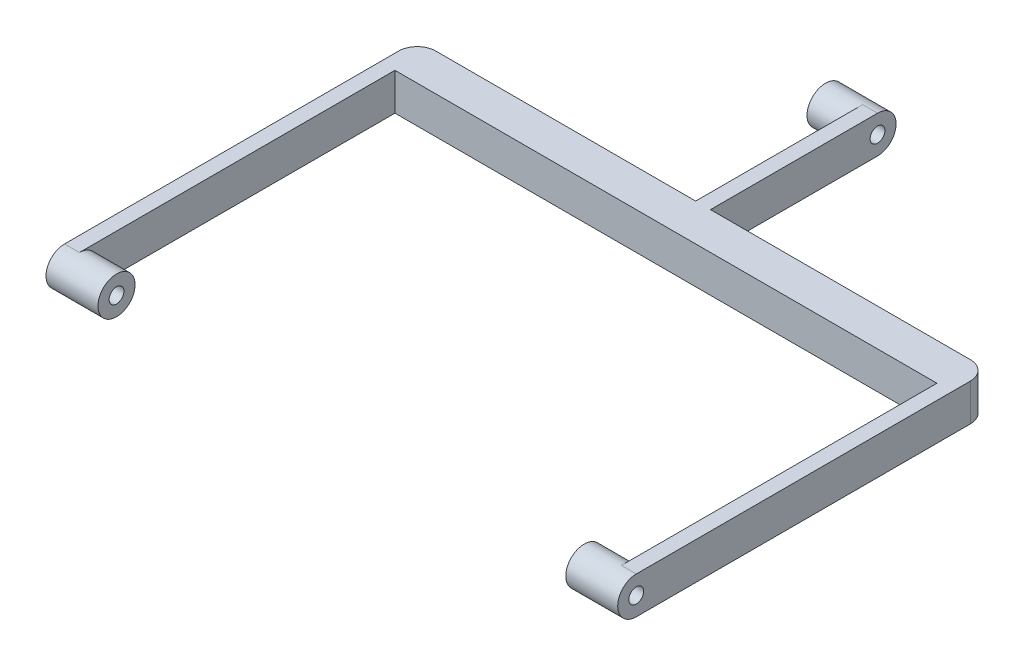
from build123d import *

# Parameters (mm, degrees)
ESBO_O1_W                  = 77
ESBO_O1_H                  = 5
RESSALTO_EXTRUS_O1_DEPTH   = 5
ESBO_O2_W                  = 2
ESBO_O2_H                  = 50
RESSALTO_EXTRUS_O2_DEPTH   = 5
FILETE1_R                  = 2.5
ESBO_O7_R                  = 2.5
RESSALTO_EXTRUS_O5_DEPTH   = 5
ESBO_O3_R                  = 1
CORTE_EXTRUS_O1_DEPTH      = 62.347371582
FILETE1_OF_ESPELHAR1_R     = 2.5
FILETE2_R                  = 2.5
ESBO_O4_W                  = 30
ESBO_O4_H                  = 5
RESSALTO_EXTRUS_O3_DEPTH   = 1
FILETE3_R                  = 2.5
ESBO_O6_R                  = 2.5
RESSALTO_EXTRUS_O4_DEPTH   = 5
CORTE_EXTRUS_O2_DEPTH      = 62.347371582
CORTE_EXTRUS_O2_DEPTH_BACK = 62.347371582
ESBO_O5_R                  = 1


with BuildPart() as part:
    # Esboço1 → Ressalto-extrusão1 (new body)
    with BuildSketch(Plane(origin=(0, 0, 0), x_dir=(1, 0, 0), z_dir=(0, 1, 0))):
        Rectangle(ESBO_O1_W, ESBO_O1_H)
    extrude(amount=RESSALTO_EXTRUS_O1_DEPTH)

    # Esboço2 → Ressalto-extrusão2 (add)
    with BuildSketch(Plane(origin=(0, 0, 0), x_dir=(1, 0, 0), z_dir=(0, 1, 0))):
        with Locations((-37.5, -22.5)):
            Rectangle(ESBO_O2_W, ESBO_O2_H)
    ressalto_extrus_o2 = extrude(amount=RESSALTO_EXTRUS_O2_DEPTH)

    # Filete1
    filete1_edges = [part.edges().sort_by_distance(p)[0] for p in [
        (-37.5, 0, 47.5),
        (-37.5, 5, 47.5),
    ]]
    fillet(filete1_edges, radius=FILETE1_R - 0.0001)  # a hair under: the kernel refuses the full size

    # Esboço7 → Ressalto-extrusão5 (add)
    with BuildSketch(Plane(origin=(-36.5, 0, 0), x_dir=(0, 0, -1), z_dir=(1, 0, 0))):
        with Locations((-45, 2.5)):
            Circle(ESBO_O7_R)
    ressalto_extrus_o5 = extrude(amount=RESSALTO_EXTRUS_O5_DEPTH)

    # Esboço3 → Corte-extrusão1 (cut, through all)
    with BuildSketch(Plane(origin=(0, 0, 0), x_dir=(0, 0, -1), z_dir=(1, 0, 0))):
        with Locations((-45, 2.5)):
            Circle(ESBO_O3_R)
    corte_extrus_o1 = extrude(amount=-CORTE_EXTRUS_O1_DEPTH, mode=Mode.SUBTRACT)

    # Espelhar1: Ressalto-extrusão2, Ressalto-extrusão5, Corte-extrusão1 across plane
    add(ressalto_extrus_o2.mirror(Plane(origin=(0, 0, 0), x_dir=(0, 0, 1), z_dir=(1, 0, 0))))
    add(ressalto_extrus_o5.mirror(Plane(origin=(0, 0, 0), x_dir=(0, 0, 1), z_dir=(1, 0, 0))))
    add(corte_extrus_o1.mirror(Plane(origin=(0, 0, 0), x_dir=(0, 0, 1), z_dir=(1, 0, 0))), mode=Mode.SUBTRACT)

    # Filete1 of Espelhar1
    filete1_of_espelhar1_edges = [part.edges().sort_by_distance(p)[0] for p in [
        (37.5, 0, 47.5),
        (37.5, 5, 47.5),
    ]]
    fillet(filete1_of_espelhar1_edges, radius=FILETE1_OF_ESPELHAR1_R - 0.0001)  # a hair under: the kernel refuses the full size

    # Filete2
    filete2_edges = [part.edges().sort_by_distance(p)[0] for p in [
        (-38.5, 2.5, -2.5),
        (38.5, 2.5, -2.5),
    ]]
    fillet(filete2_edges, radius=FILETE2_R)

    # Esboço4 → Ressalto-extrusão3 (add, symmetric)
    with BuildSketch(Plane(origin=(0, 0, 0), x_dir=(0, 0, -1), z_dir=(1, 0, 0))):
        with Locations((12.5, 2.5)):
            Rectangle(ESBO_O4_W, ESBO_O4_H)
    extrude(amount=RESSALTO_EXTRUS_O3_DEPTH, both=True)

    # Filete3
    filete3_edges = [part.edges().sort_by_distance(p)[0] for p in [
        (0, 5, -27.5),
        (0, 0, -27.5),
    ]]
    fillet(filete3_edges, radius=FILETE3_R - 0.0001)  # a hair under: the kernel refuses the full size

    # Esboço6 → Ressalto-extrusão4 (add)
    with BuildSketch(Plane.ZY.offset(1)):
        with Locations((-25, 2.5)):
            Circle(ESBO_O6_R)
    extrude(amount=RESSALTO_EXTRUS_O4_DEPTH)

    # Esboço5 → Corte-extrusão2 (cut, two sides: drawn at the far end of the back side and taken through both)
    with BuildSketch(Plane(origin=(0, 0, 0), x_dir=(0, 0, -1), z_dir=(1, 0, 0)).offset(-CORTE_EXTRUS_O2_DEPTH_BACK)):
        with Locations((25, 2.5)):
            Circle(ESBO_O5_R)
    extrude(amount=CORTE_EXTRUS_O2_DEPTH + CORTE_EXTRUS_O2_DEPTH_BACK, mode=Mode.SUBTRACT)


solid = part.part
